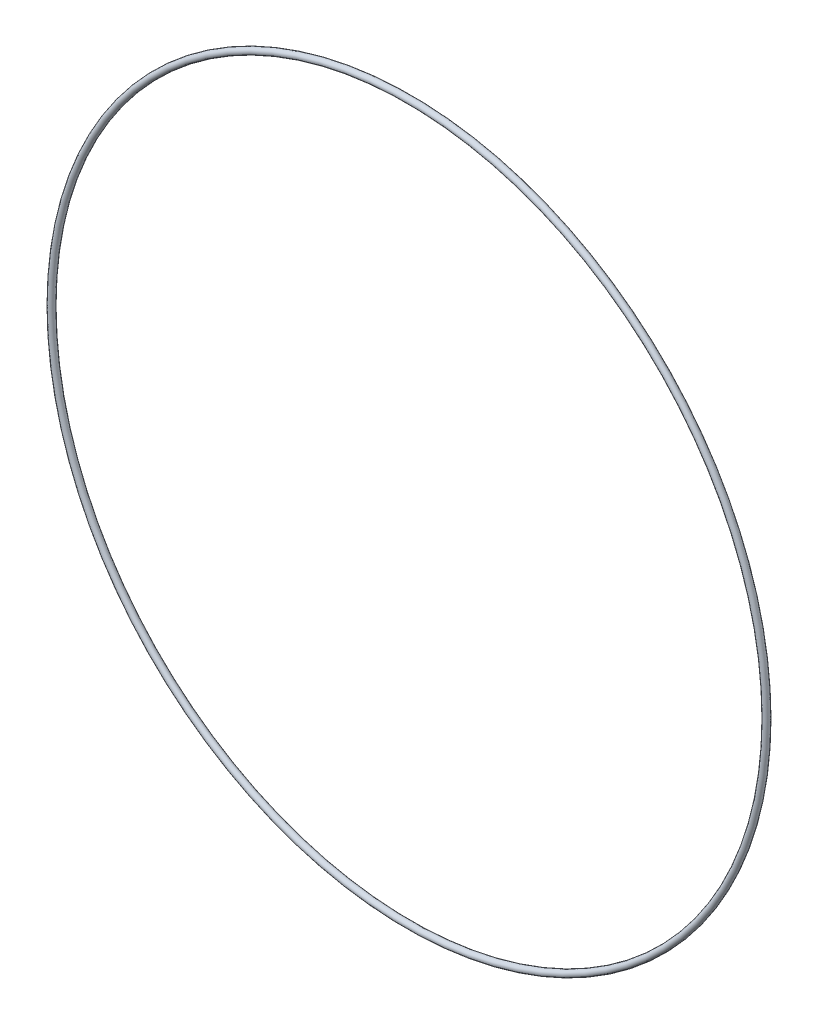
from build123d import *

# Parameters (mm, degrees)
SKETCH3_R = 1


with BuildPart() as part:
    # Sketch3 → Revolve1 (revolve)
    with BuildSketch(Plane(origin=(0, 0, 0), x_dir=(0, 0, -1), z_dir=(1, 0, 0))):
        with Locations((0, 111.5)):
            Circle(SKETCH3_R)
    revolve(axis=Axis((0, 0, 0), (0, 0, -1)))


solid = part.part
